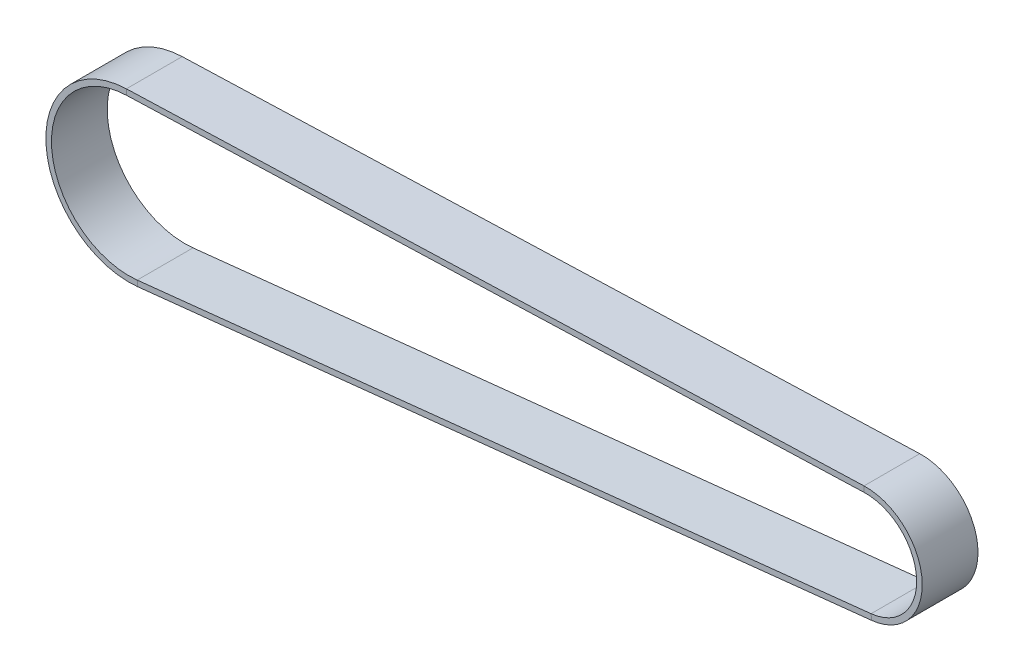
from build123d import *

# Parameters (mm, degrees)
CROQUIS3_W = 10
CROQUIS3_H = 1


with BuildPart() as part:
    # Barrer1: sweep along a path in Croquis2
    with BuildLine(Plane.XY) as barrer1_path:
        Line((0.965224878, -9.078834778), (-130.607144948, -23.067075312))
        ThreePointArc((-130.607144948, -23.067075312), (-145.948280448, -10.210409365), (-132.546701076, 4.657070851))
        Line((-132.546701076, 4.657070851), (-0.308284467, 9.124793734))
        ThreePointArc((-0.308284467, 9.124793734), (9.107739315, 0.637169184), (0.965224878, -9.078834778))
    # Croquis3 → Barrer1 (sweep)
    with BuildSketch(Plane(origin=(-0.308284467, 0, 0), x_dir=(0, 0, -1), z_dir=(1, 0, 0))):
        with Locations((0, 9.624793734)):
            Rectangle(CROQUIS3_W, CROQUIS3_H)
    sweep(path=barrer1_path.line)


solid = part.part
